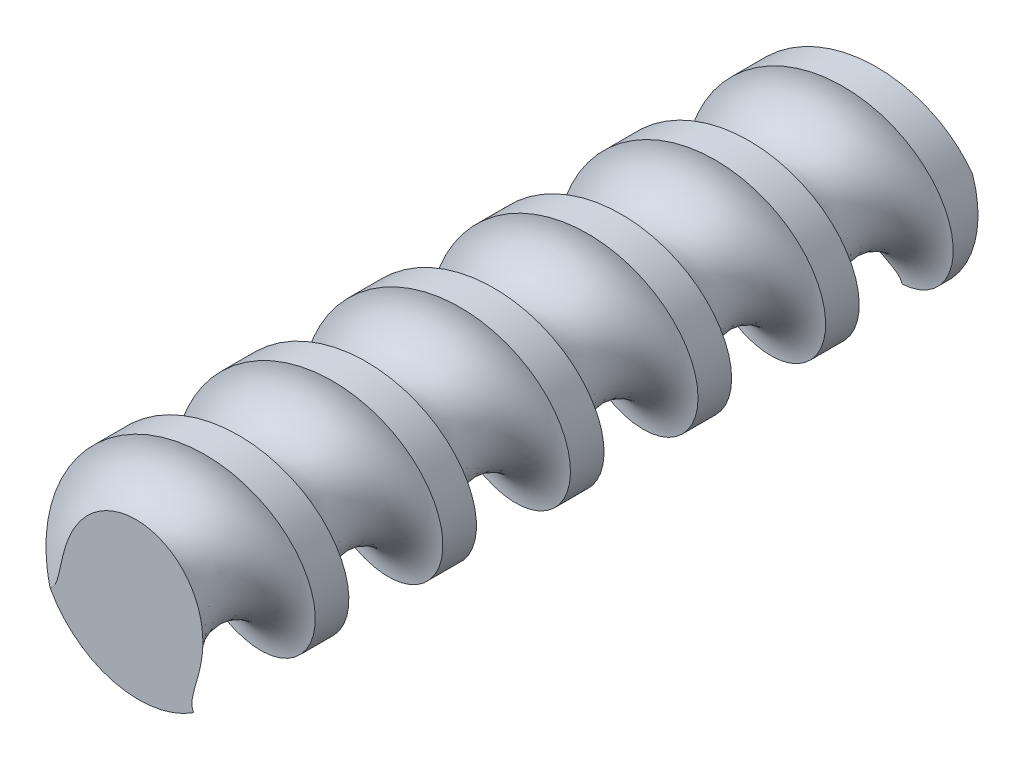
from build123d import *

# Parameters (mm, degrees)
SKETCH_1_R      = 75
EXTRUDE_1_DEPTH = 550
SWEEP_1_PITCH   = 95


with BuildPart() as part:
    # Эскиз1 → Бобышка-Вытянуть1 (new body)
    with BuildSketch(Plane.XY):
        Circle(SKETCH_1_R)
    extrude(amount=EXTRUDE_1_DEPTH)

    # Вырез-По траектории1: the profile of Эскиз4 screwed along a right-hand helix of 6.75 turns, 34 arcs to a turn; built about Z, then put on its axis
    sweep_1_z = Axis((0, 0, 0), (0, 0, 1))
    sweep_1_corners = [(110, 0, 0), (75, 0, -35), (40, 0, 0), (75, 0, 35)]
    with BuildLine(mode=Mode.PRIVATE) as sweep_1_profile:
        ThreePointArc((110, 0, 0), (99.748737342, 0, -24.748737342), (75, 0, -35))
        ThreePointArc((75, 0, -35), (50.251262658, 0, -24.748737342), (40, 0, 0))
        ThreePointArc((40, 0, 0), (50.251262658, 0, 24.748737342), (75, 0, 35))
        ThreePointArc((75, 0, 35), (99.748737342, 0, 24.748737342), (110, 0, 0))
    sweep_1_cap = Face(sweep_1_profile.wire())
    sweep_1_arcs = [((110, 0, 0), (110, 0, -35), (75, 0, -35), (1, 0.7071067811865476, 1)), ((75, 0, -35), (40, 0, -35), (40, 0, 0), (1, 0.7071067811865476, 1)), ((40, 0, 0), (40, 0, 35), (75, 0, 35), (1, 0.7071067811865476, 1)), ((75, 0, 35), (110, 0, 35), (110, 0, 0), (1, 0.7071067811865476, 1))]  # start, shoulder, end, weights
    sweep_1_turn_angles = [0, 5.294117647, 10.588235294, 15.882352941, 21.176470588, 26.470588235, 31.764705882, 37.058823529, 42.352941176, 47.647058824, 52.941176471, 58.235294118, 63.529411765, 68.823529412, 74.117647059, 79.411764706, 84.705882353, 90, 95.294117647, 100.588235294, 105.882352941, 111.176470588, 116.470588235, 121.764705882, 127.058823529, 132.352941176, 137.647058824, 142.941176471, 148.235294118, 153.529411765, 158.823529412, 164.117647059, 169.411764706, 174.705882353, 180, 185.294117647, 190.588235294, 195.882352941, 201.176470588, 206.470588235, 211.764705882, 217.058823529, 222.352941176, 227.647058824, 232.941176471, 238.235294118, 243.529411765, 248.823529412, 254.117647059, 259.411764706, 264.705882353, 270, 275.294117647, 280.588235294, 285.882352941, 291.176470588, 296.470588235, 301.764705882, 307.058823529, 312.352941176, 317.647058824, 322.941176471, 328.235294118, 333.529411765, 338.823529412, 344.117647059, 349.411764706, 354.705882353, 360]
    sweep_1_turn_weights = [1, 0.9957341762950345, 1, 0.9957341762950345, 1, 0.9957341762950345, 1, 0.9957341762950346, 1, 0.9957341762950346, 1, 0.9957341762950345, 1, 0.9957341762950346, 1, 0.9957341762950345, 1, 0.9957341762950345, 1, 0.9957341762950346, 1, 0.9957341762950345, 1, 0.9957341762950345, 1, 0.9957341762950345, 1, 0.9957341762950346, 1, 0.9957341762950345, 1, 0.9957341762950345, 1, 0.9957341762950345, 1, 0.9957341762950345, 1, 0.9957341762950346, 1, 0.9957341762950345, 1, 0.9957341762950345, 1, 0.9957341762950345, 1, 0.9957341762950345, 1, 0.9957341762950345, 1, 0.9957341762950346, 1, 0.9957341762950345, 1, 0.9957341762950346, 1, 0.9957341762950346, 1, 0.9957341762950345, 1, 0.9957341762950346, 1, 0.9957341762950345, 1, 0.9957341762950346, 1, 0.9957341762950346, 1, 0.9957341762950345, 1]
    sweep_1_turn_sides = [Face.make_bezier_surface([[Vector(p[j][0], p[j][1], 0).rotate(sweep_1_z, sweep_1_turn_angles[2 * i + k]) / sweep_1_turn_weights[2 * i + k] + Vector(0, 0, p[j][2] + SWEEP_1_PITCH * sweep_1_turn_angles[2 * i + k] / 360) for k in range(3)] for j in range(3)], [[p[3][j] * sweep_1_turn_weights[2 * i + k] for k in range(3)] for j in range(3)]) for p in sweep_1_arcs for i in range(34)]
    sweep_1_last_angles = [2160, 2165.294117647, 2170.588235294, 2175.882352941, 2181.176470588, 2186.470588235, 2191.764705882, 2197.058823529, 2202.352941176, 2207.647058824, 2212.941176471, 2218.235294118, 2223.529411765, 2228.823529412, 2234.117647059, 2239.411764706, 2244.705882353, 2250, 2255.294117647, 2260.588235294, 2265.882352941, 2271.176470588, 2276.470588235, 2281.764705882, 2287.058823529, 2292.352941176, 2297.647058824, 2302.941176471, 2308.235294118, 2313.529411765, 2318.823529412, 2324.117647059, 2329.411764706, 2334.705882353, 2340, 2345.294117647, 2350.588235294, 2355.882352941, 2361.176470588, 2366.470588235, 2371.764705882, 2377.058823529, 2382.352941176, 2387.647058824, 2392.941176471, 2398.235294118, 2403.529411765, 2408.823529412, 2414.117647059, 2419.411764706, 2424.705882353, 2427.352941176, 2430]
    sweep_1_last_weights = [1, 0.9957341762950346, 1, 0.9957341762950346, 1, 0.9957341762950342, 1, 0.9957341762950346, 1, 0.9957341762950346, 1, 0.9957341762950346, 1, 0.9957341762950346, 1, 0.9957341762950346, 1, 0.9957341762950342, 1, 0.9957341762950346, 1, 0.9957341762950346, 1, 0.9957341762950346, 1, 0.9957341762950346, 1, 0.9957341762950346, 1, 0.9957341762950342, 1, 0.9957341762950346, 1, 0.9957341762950346, 1, 0.9957341762950346, 1, 0.9957341762950346, 1, 0.9957341762950342, 1, 0.9957341762950346, 1, 0.9957341762950346, 1, 0.9957341762950346, 1, 0.9957341762950346, 1, 0.9957341762950346, 1, 0.9989329748023685, 1]
    sweep_1_last_sides = [Face.make_bezier_surface([[Vector(p[j][0], p[j][1], 0).rotate(sweep_1_z, sweep_1_last_angles[2 * i + k]) / sweep_1_last_weights[2 * i + k] + Vector(0, 0, p[j][2] + SWEEP_1_PITCH * sweep_1_last_angles[2 * i + k] / 360) for k in range(3)] for j in range(3)], [[p[3][j] * sweep_1_last_weights[2 * i + k] for k in range(3)] for j in range(3)]) for p in sweep_1_arcs for i in range(26)]
    sweep_1 = Plane(origin=(0, 0, -40), x_dir=(1, 0, 0), z_dir=(0, 0, 1)) * Solid(Shell([*[p.moved(Location((0, 0, SWEEP_1_PITCH * i))) for i in range(6) for p in sweep_1_turn_sides], *sweep_1_last_sides, sweep_1_cap, sweep_1_cap.rotate(sweep_1_z, 2430).moved(Location((0, 0, SWEEP_1_PITCH * 2430 / 360)))]))
    add(sweep_1, mode=Mode.SUBTRACT)


solid = part.part
